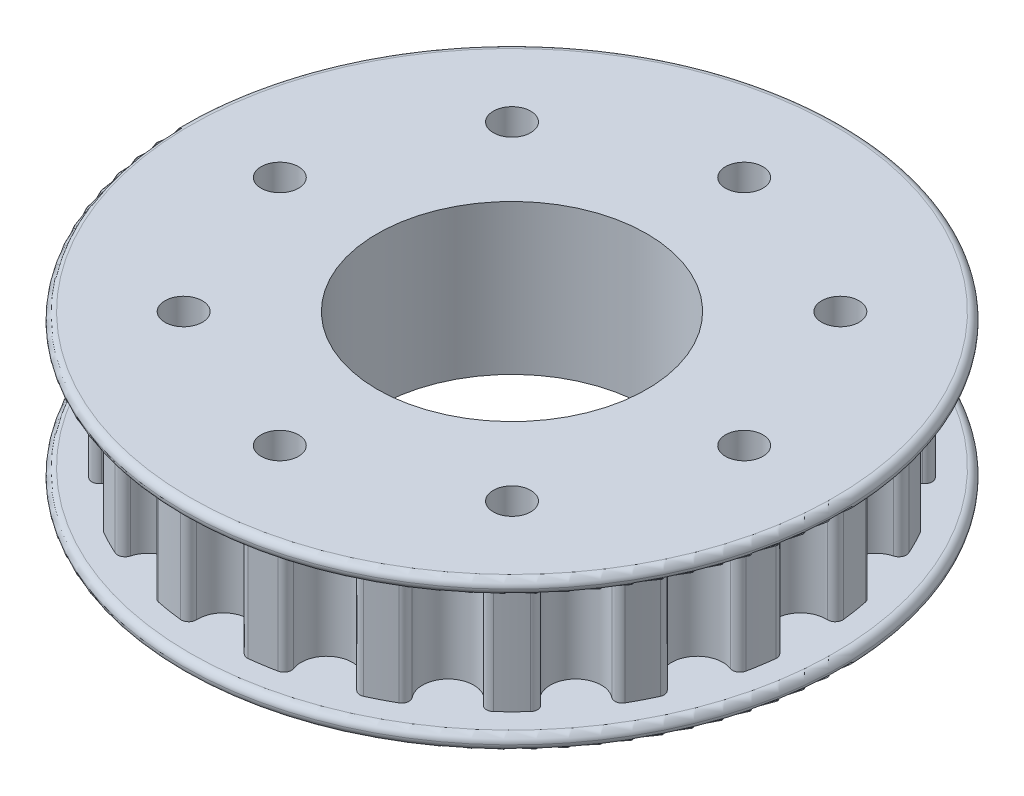
from build123d import *

# Parameters (mm, degrees)
EXTRUDE_1_DEPTH     = 8
SKETCH_2_R          = 22
EXTRUDE_2_DEPTH     = 1
FILLET_1_R          = 0.5
EXTRUDE_START       = 1
SKETCH_3_R          = 22
EXTRUDE_3_DEPTH     = 1
FILLET_2_R          = 0.5
HOLE_WIZARD_M3_1_D  = 2.5
SKETCH_9_R          = 9
CUT_EXTRUDE_2_DEPTH = 33.680269442


with BuildPart() as part:
    # 草图1 → 凸台-拉伸1 (new body)
    with BuildSketch(Plane(origin=(0, 0, 0), x_dir=(1, 0, 0), z_dir=(0, 1, 0))):
        with BuildLine():
            ThreePointArc((-19.598458084, 3.987535674), (-19.753766812, 3.128689301), (-19.871457558, 2.263884825))
            ThreePointArc((-19.871457558, 2.263884825), (-19.739336252, 1.865206806), (-19.349906932, 1.707901346))
            ThreePointArc((-19.349906932, 1.707901346), (-17.555213412, 0), (-19.349906932, -1.707901346))
            ThreePointArc((-19.349906932, -1.707901346), (-19.739336252, -1.865206806), (-19.871457558, -2.263884825))
            ThreePointArc((-19.871457558, -2.263884825), (-19.753766812, -3.128689301), (-19.598458084, -3.987535674))
            ThreePointArc((-19.598458084, -3.987535674), (-19.349604971, -4.325873273), (-18.930625618, -4.355139377))
            ThreePointArc((-18.930625618, -4.355139377), (-16.69600011, -5.424859284), (-17.875084537, -7.603760786))
            ThreePointArc((-17.875084537, -7.603760786), (-18.196843769, -7.873707446), (-18.199300315, -8.293700504))
            ThreePointArc((-18.199300315, -8.293700504), (-17.820130484, -9.079809995), (-17.407024981, -9.848628398))
            ThreePointArc((-17.407024981, -9.848628398), (-17.065799538, -10.093506735), (-16.658282771, -9.991868714))
            ThreePointArc((-16.658282771, -9.991868714), (-14.20246599, -10.318695544), (-14.650524324, -12.755311142))
            ThreePointArc((-14.650524324, -12.755311142), (-14.873117433, -13.111474743), (-14.745668755, -13.511670991))
            ThreePointArc((-14.745668755, -13.511670991), (-14.142135624, -14.142135624), (-13.511670991, -14.745668755))
            ThreePointArc((-13.511670991, -14.745668755), (-13.111474743, -14.873117433), (-12.755311142, -14.650524324))
            ThreePointArc((-12.755311142, -14.650524324), (-10.318695544, -14.20246599), (-9.991868714, -16.658282771))
            ThreePointArc((-9.991868714, -16.658282771), (-10.093506735, -17.065799538), (-9.848628398, -17.407024981))
            ThreePointArc((-9.848628398, -17.407024981), (-9.079809995, -17.820130484), (-8.293700504, -18.199300315))
            ThreePointArc((-8.293700504, -18.199300315), (-7.873707446, -18.196843769), (-7.603760786, -17.875084537))
            ThreePointArc((-7.603760786, -17.875084537), (-5.424859284, -16.69600011), (-4.355139377, -18.930625618))
            ThreePointArc((-4.355139377, -18.930625618), (-4.325873273, -19.349604971), (-3.987535674, -19.598458084))
            ThreePointArc((-3.987535674, -19.598458084), (-3.128689301, -19.753766812), (-2.263884825, -19.871457558))
            ThreePointArc((-2.263884825, -19.871457558), (-1.865206806, -19.739336252), (-1.707901346, -19.349906932))
            ThreePointArc((-1.707901346, -19.349906932), (0, -17.555213412), (1.707901346, -19.349906932))
            ThreePointArc((1.707901346, -19.349906932), (1.865206806, -19.739336252), (2.263884825, -19.871457558))
            ThreePointArc((2.263884825, -19.871457558), (3.128689301, -19.753766812), (3.987535674, -19.598458084))
            ThreePointArc((3.987535674, -19.598458084), (4.325873273, -19.349604971), (4.355139377, -18.930625618))
            ThreePointArc((4.355139377, -18.930625618), (5.424859284, -16.69600011), (7.603760786, -17.875084537))
            ThreePointArc((7.603760786, -17.875084537), (7.873707446, -18.196843769), (8.293700504, -18.199300315))
            ThreePointArc((8.293700504, -18.199300315), (9.079809995, -17.820130484), (9.848628398, -17.407024981))
            ThreePointArc((9.848628398, -17.407024981), (10.093506735, -17.065799538), (9.991868714, -16.658282771))
            ThreePointArc((9.991868714, -16.658282771), (10.318695544, -14.20246599), (12.755311142, -14.650524324))
            ThreePointArc((12.755311142, -14.650524324), (13.111474743, -14.873117433), (13.511670991, -14.745668755))
            ThreePointArc((13.511670991, -14.745668755), (14.142135624, -14.142135624), (14.745668755, -13.511670991))
            ThreePointArc((14.745668755, -13.511670991), (14.873117433, -13.111474743), (14.650524324, -12.755311142))
            ThreePointArc((14.650524324, -12.755311142), (14.20246599, -10.318695544), (16.658282771, -9.991868714))
            ThreePointArc((16.658282771, -9.991868714), (17.065799538, -10.093506735), (17.407024981, -9.848628398))
            ThreePointArc((17.407024981, -9.848628398), (17.820130484, -9.079809995), (18.199300315, -8.293700504))
            ThreePointArc((18.199300315, -8.293700504), (18.196843769, -7.873707446), (17.875084537, -7.603760786))
            ThreePointArc((17.875084537, -7.603760786), (16.69600011, -5.424859284), (18.930625618, -4.355139377))
            ThreePointArc((18.930625618, -4.355139377), (19.349604971, -4.325873273), (19.598458084, -3.987535674))
            ThreePointArc((19.598458084, -3.987535674), (19.753766812, -3.128689301), (19.871457558, -2.263884825))
            ThreePointArc((19.871457558, -2.263884825), (19.739336252, -1.865206806), (19.349906932, -1.707901346))
            ThreePointArc((19.349906932, -1.707901346), (17.555213412, 0), (19.349906932, 1.707901346))
            ThreePointArc((19.349906932, 1.707901346), (19.739336252, 1.865206806), (19.871457558, 2.263884825))
            ThreePointArc((19.871457558, 2.263884825), (19.753766812, 3.128689301), (19.598458084, 3.987535674))
            ThreePointArc((19.598458084, 3.987535674), (19.349604971, 4.325873273), (18.930625618, 4.355139377))
            ThreePointArc((18.930625618, 4.355139377), (16.69600011, 5.424859284), (17.875084537, 7.603760786))
            ThreePointArc((17.875084537, 7.603760786), (18.196843769, 7.873707446), (18.199300315, 8.293700504))
            ThreePointArc((18.199300315, 8.293700504), (17.820130484, 9.079809995), (17.407024981, 9.848628398))
            ThreePointArc((17.407024981, 9.848628398), (17.065799538, 10.093506735), (16.658282771, 9.991868714))
            ThreePointArc((16.658282771, 9.991868714), (14.20246599, 10.318695544), (14.650524324, 12.755311142))
            ThreePointArc((14.650524324, 12.755311142), (14.873117433, 13.111474743), (14.745668755, 13.511670991))
            ThreePointArc((14.745668755, 13.511670991), (14.142135624, 14.142135624), (13.511670991, 14.745668755))
            ThreePointArc((13.511670991, 14.745668755), (13.111474743, 14.873117433), (12.755311142, 14.650524324))
            ThreePointArc((12.755311142, 14.650524324), (10.318695544, 14.20246599), (9.991868714, 16.658282771))
            ThreePointArc((9.991868714, 16.658282771), (10.093506735, 17.065799538), (9.848628398, 17.407024981))
            ThreePointArc((9.848628398, 17.407024981), (9.079809995, 17.820130484), (8.293700504, 18.199300315))
            ThreePointArc((8.293700504, 18.199300315), (7.873707446, 18.196843769), (7.603760786, 17.875084537))
            ThreePointArc((7.603760786, 17.875084537), (5.424859284, 16.69600011), (4.355139377, 18.930625618))
            ThreePointArc((4.355139377, 18.930625618), (4.325873273, 19.349604971), (3.987535674, 19.598458084))
            ThreePointArc((3.987535674, 19.598458084), (3.128689301, 19.753766812), (2.263884825, 19.871457558))
            ThreePointArc((2.263884825, 19.871457558), (1.865206806, 19.739336252), (1.707901346, 19.349906932))
            ThreePointArc((1.707901346, 19.349906932), (0, 17.555213412), (-1.707901346, 19.349906932))
            ThreePointArc((-1.707901346, 19.349906932), (-1.865206806, 19.739336252), (-2.263884825, 19.871457558))
            ThreePointArc((-2.263884825, 19.871457558), (-3.128689301, 19.753766812), (-3.987535674, 19.598458084))
            ThreePointArc((-3.987535674, 19.598458084), (-4.325873273, 19.349604971), (-4.355139377, 18.930625618))
            ThreePointArc((-4.355139377, 18.930625618), (-5.424859284, 16.69600011), (-7.603760786, 17.875084537))
            ThreePointArc((-7.603760786, 17.875084537), (-7.873707446, 18.196843769), (-8.293700504, 18.199300315))
            ThreePointArc((-8.293700504, 18.199300315), (-9.079809995, 17.820130484), (-9.848628398, 17.407024981))
            ThreePointArc((-9.848628398, 17.407024981), (-10.093506735, 17.065799538), (-9.991868714, 16.658282771))
            ThreePointArc((-9.991868714, 16.658282771), (-10.318695544, 14.20246599), (-12.755311142, 14.650524324))
            ThreePointArc((-12.755311142, 14.650524324), (-13.111474743, 14.873117433), (-13.511670991, 14.745668755))
            ThreePointArc((-13.511670991, 14.745668755), (-14.142135624, 14.142135624), (-14.745668755, 13.511670991))
            ThreePointArc((-14.745668755, 13.511670991), (-14.873117433, 13.111474743), (-14.650524324, 12.755311142))
            ThreePointArc((-14.650524324, 12.755311142), (-14.20246599, 10.318695544), (-16.658282771, 9.991868714))
            ThreePointArc((-16.658282771, 9.991868714), (-17.065799538, 10.093506735), (-17.407024981, 9.848628398))
            ThreePointArc((-17.407024981, 9.848628398), (-17.820130484, 9.079809995), (-18.199300315, 8.293700504))
            ThreePointArc((-18.199300315, 8.293700504), (-18.196843769, 7.873707446), (-17.875084537, 7.603760786))
            ThreePointArc((-17.875084537, 7.603760786), (-16.69600011, 5.424859284), (-18.930625618, 4.355139377))
            ThreePointArc((-18.930625618, 4.355139377), (-19.349604971, 4.325873273), (-19.598458084, 3.987535674))
        make_face()
    extrude(amount=EXTRUDE_1_DEPTH)

    # 草图2 → 凸台-拉伸2 (add)
    with BuildSketch(Plane(origin=(0, 0, 0), x_dir=(1, 0, 0), z_dir=(0, 1, 0))):
        with Locations(Location((0, 0, 0), (0, 0, 270))):
            Circle(SKETCH_2_R)
    extrude(amount=-EXTRUDE_2_DEPTH)

    # 圆角1
    fillet_1_edges = [part.edges().sort_by_distance(p)[0] for p in [
        (0, 0, -22),
        (0, -1, -22),
    ]]
    fillet(fillet_1_edges, radius=FILLET_1_R - 0.0001)  # a hair under: the kernel refuses the full size

    # 草图3 → 凸台-拉伸3 (add)
    with BuildSketch(Plane(origin=(0, 8, 0), x_dir=(1, 0, 0), z_dir=(0, 1, 0)).offset(EXTRUDE_START)):
        with Locations(Location((0, 0, 0), (0, 0, 270))):
            Circle(SKETCH_3_R)
    extrude(amount=-EXTRUDE_3_DEPTH)

    # 圆角2
    fillet_2_edges = [part.edges().sort_by_distance(p)[0] for p in [
        (0, 8, -22),
        (0, 9, -22),
    ]]
    fillet(fillet_2_edges, radius=FILLET_2_R - 0.0001)  # a hair under: the kernel refuses the full size

    # M3 螺纹孔的螺纹孔钻头1 (through all)
    with Locations(Plane(origin=(-10.960155108, 9, -10.960155108), x_dir=(0, 0, 1), z_dir=(0, 1, 0))):
        with Locations((0, 0), (-4.539844892, 10.960155108), (0, 21.920310216), (10.960155108, 26.460155108), (21.920310216, 21.920310216), (26.460155108, 10.960155108), (21.920310216, 0), (10.960155108, -4.539844892)):
            Hole(HOLE_WIZARD_M3_1_D / 2)

    # 草图9 → 切除-拉伸2 (cut, through all)
    with BuildSketch(Plane(origin=(0, 9, 0), x_dir=(1, 0, 0), z_dir=(0, 1, 0))):
        with Locations(Location((0, 0, 0), (0, 0, 270))):
            Circle(SKETCH_9_R)
    extrude(amount=-CUT_EXTRUDE_2_DEPTH, mode=Mode.SUBTRACT)


solid = part.part
